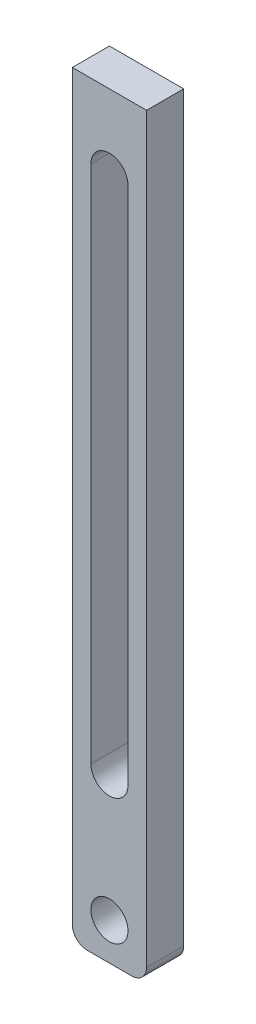
from build123d import *

# Parameters (mm, degrees)
SKETCH1_R               = 3.175
BOSS_EXTRUDE1_DEPTH     = 6.35
CUT_EXTRUDE1_DEPTH      = 66.389585562
CUT_EXTRUDE1_DEPTH_BACK = 66.389585562


with BuildPart() as part:
    # Sketch1 → Boss-Extrude1 (new body)
    with BuildSketch(Plane.XY):
        with BuildLine():
            Line((-3.81, -64.77), (3.81, -64.77))
            ThreePointArc((3.81, -64.77), (5.606051224, -64.026051224), (6.35, -62.23))
            Line((6.35, -62.23), (6.35, 64.77))
            Line((6.35, 64.77), (-6.35, 64.77))
            Line((-6.35, 64.77), (-6.35, -62.23))
            ThreePointArc((-6.35, -62.23), (-5.606051224, -64.026051224), (-3.81, -64.77))
        make_face()
        with Locations((0, -58.42)):
            Circle(SKETCH1_R, mode=Mode.SUBTRACT)
    extrude(amount=BOSS_EXTRUDE1_DEPTH)

    # Sketch2 → Cut-Extrude1 (cut, two sides: drawn at the far end of the back side and taken through both)
    with BuildSketch(Plane.XY.offset(6.35).offset(-CUT_EXTRUDE1_DEPTH_BACK)):
        with BuildLine():
            Line((-3.175, -36.83), (-3.175, 52.07))
            ThreePointArc((-3.175, 52.07), (0, 55.245), (3.175, 52.07))
            Line((3.175, 52.07), (3.175, -36.83))
            ThreePointArc((3.175, -36.83), (0, -40.005), (-3.175, -36.83))
        make_face()
    extrude(amount=CUT_EXTRUDE1_DEPTH + CUT_EXTRUDE1_DEPTH_BACK, mode=Mode.SUBTRACT)


solid = part.part
